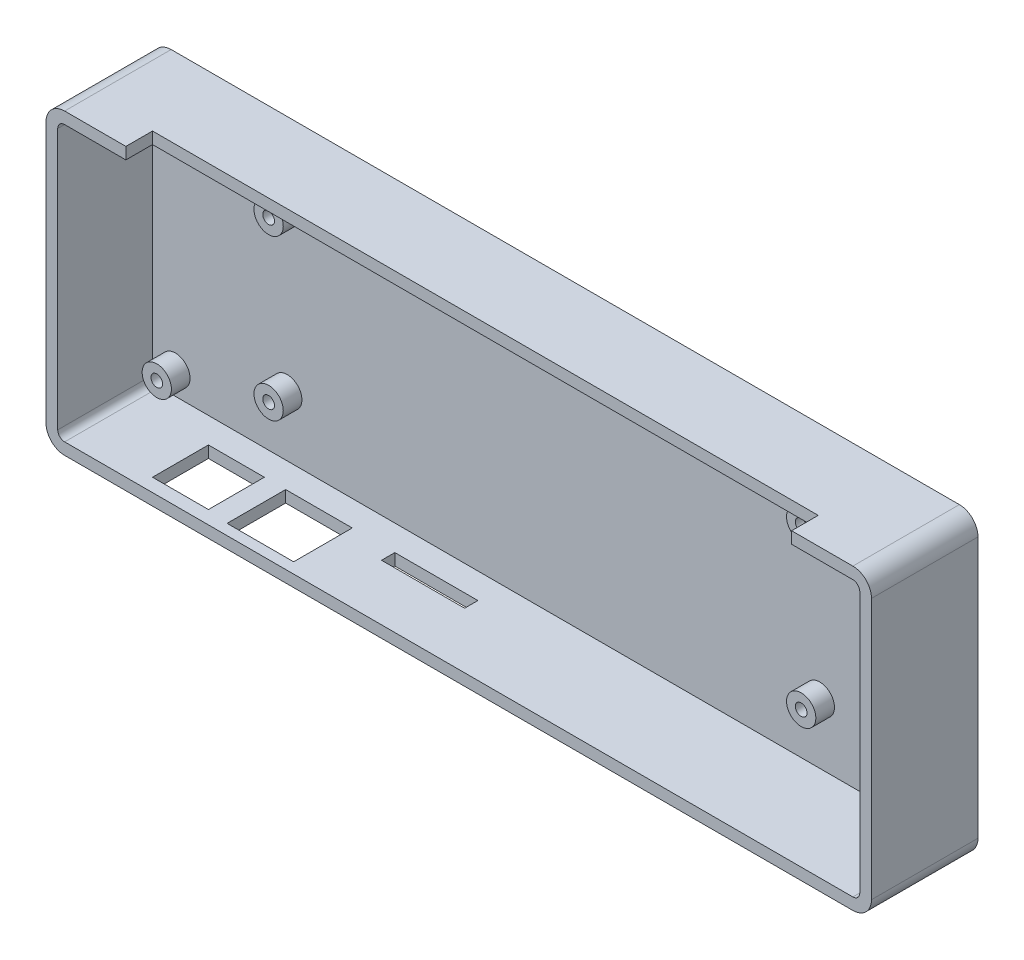
from build123d import *

# Parameters (mm, degrees)
SKETCH_1_W          = 155
SKETCH_1_H          = 56
EXTRUDE_1_DEPTH     = 20
FILLET_1_R          = 3.5
SHELL_1_T           = -2.2
SKETCH_2_R          = 1.1
CUT_EXTRUDE_1_DEPTH = 10
EXTRUDE_START       = 3.5
SKETCH_3_R          = 2.75
SKETCH_3_R_2        = 1.1
EXTRUDE_2_DEPTH     = 3.5
SKETCH_4_W          = 10.5
SKETCH_4_H          = 10.5
SKETCH_4_W_2        = 12.5
SKETCH_4_H_2        = 11
SKETCH_4_W_3        = 15.6
SKETCH_4_H_3        = 2.5
CUT_EXTRUDE_2_DEPTH = 3
SKETCH_5_W          = 125
SKETCH_5_H          = 5
CUT_EXTRUDE_3_DEPTH = 3


with BuildPart() as part:
    # 草图1 → 凸台-拉伸1 (new body)
    with BuildSketch(Plane.XY):
        with Locations((77.5, -28)):
            Rectangle(SKETCH_1_W, SKETCH_1_H)
    extrude(amount=EXTRUDE_1_DEPTH)

    # 圆角1
    fillet_1_edges = [part.edges().sort_by_distance(p)[0] for p in [
        (0, 0, 10),
        (0, -56, 10),
        (155, 0, 10),
        (155, -56, 10),
    ]]
    fillet(fillet_1_edges, radius=FILLET_1_R)

    # 抽壳1
    shell_1_openings = [part.faces().sort_by_distance(p)[0] for p in [
        (77.5, -28, 20),
    ]]
    offset(amount=SHELL_1_T, openings=shell_1_openings, kind=Kind.INTERSECTION)

    # 草图2 → 切除-拉伸1 (cut)
    with BuildSketch(Plane.XY.offset(2.2)):
        with Locations((27.5, -12.5)):
            Circle(SKETCH_2_R)
        with Locations((127.5, -12.5)):
            Circle(SKETCH_2_R)
        with Locations((127.5, -42.5)):
            Circle(SKETCH_2_R)
        with Locations((27.5, -42.5)):
            Circle(SKETCH_2_R)
    extrude(amount=-CUT_EXTRUDE_1_DEPTH, mode=Mode.SUBTRACT)

    # 草图3 → 凸台-拉伸2 (add)
    # profile 1 of 8: a face of its own
    with BuildSketch(Plane.XY.offset(2.2).offset(EXTRUDE_START)):
        with Locations((27.5, -12.5)):
            Circle(SKETCH_3_R)
        with Locations((27.5, -12.5)):
            Circle(SKETCH_3_R_2, mode=Mode.SUBTRACT)
    # profile 2 of 8: a face of its own
    with BuildSketch(Plane.XY.offset(2.2).offset(EXTRUDE_START)):
        with Locations((127.5, -12.5)):
            Circle(SKETCH_3_R)
        with Locations((127.5, -12.5)):
            Circle(SKETCH_3_R_2, mode=Mode.SUBTRACT)
    # profile 3 of 8: a face of its own
    with BuildSketch(Plane.XY.offset(2.2).offset(EXTRUDE_START)):
        with Locations((127.5, -42.5)):
            Circle(SKETCH_3_R)
        with Locations((127.5, -42.5)):
            Circle(SKETCH_3_R_2, mode=Mode.SUBTRACT)
    # profile 4 of 8: a face of its own
    with BuildSketch(Plane.XY.offset(2.2).offset(EXTRUDE_START)):
        with Locations((27.5, -42.5)):
            Circle(SKETCH_3_R)
        with Locations((27.5, -42.5)):
            Circle(SKETCH_3_R_2, mode=Mode.SUBTRACT)
    # profile 5 of 8: a face of its own
    with BuildSketch(Plane.XY.offset(2.2).offset(EXTRUDE_START)):
        with Locations((6.5, -7.5)):
            Circle(SKETCH_3_R)
        with Locations((6.5, -7.5)):
            Circle(SKETCH_3_R_2, mode=Mode.SUBTRACT)
    # profile 6 of 8: a face of its own
    with BuildSketch(Plane.XY.offset(2.2).offset(EXTRUDE_START)):
        with Locations((148.5, -7.5)):
            Circle(SKETCH_3_R)
        with Locations((148.5, -7.5)):
            Circle(SKETCH_3_R_2, mode=Mode.SUBTRACT)
    # profile 7 of 8: a face of its own
    with BuildSketch(Plane.XY.offset(2.2).offset(EXTRUDE_START)):
        with Locations((148.5, -49.5)):
            Circle(SKETCH_3_R)
        with Locations((148.5, -49.5)):
            Circle(SKETCH_3_R_2, mode=Mode.SUBTRACT)
    # profile 8 of 8: a face of its own
    with BuildSketch(Plane.XY.offset(2.2).offset(EXTRUDE_START)):
        with Locations((6.5, -49.5)):
            Circle(SKETCH_3_R)
        with Locations((6.5, -49.5)):
            Circle(SKETCH_3_R_2, mode=Mode.SUBTRACT)
    extrude(amount=-EXTRUDE_2_DEPTH)

    # 草图4 → 切除-拉伸2 (cut)
    with BuildSketch(Plane.XZ.offset(56)):
        with Locations((22.75, 12.25)):
            Rectangle(SKETCH_4_W, SKETCH_4_H)
        with Locations((38.25, 12.5)):
            Rectangle(SKETCH_4_W_2, SKETCH_4_H_2)
        with Locations((60.3, 8.25)):
            Rectangle(SKETCH_4_W_3, SKETCH_4_H_3)
    extrude(amount=-CUT_EXTRUDE_2_DEPTH, mode=Mode.SUBTRACT)

    # 草图5 → 切除-拉伸3 (cut)
    with BuildSketch(Plane(origin=(0, 0, 0), x_dir=(1, 0, 0), z_dir=(0, 1, 0))):
        with Locations((77.5, -17.5)):
            Rectangle(SKETCH_5_W, SKETCH_5_H)
    extrude(amount=-CUT_EXTRUDE_3_DEPTH, mode=Mode.SUBTRACT)


solid = part.part
